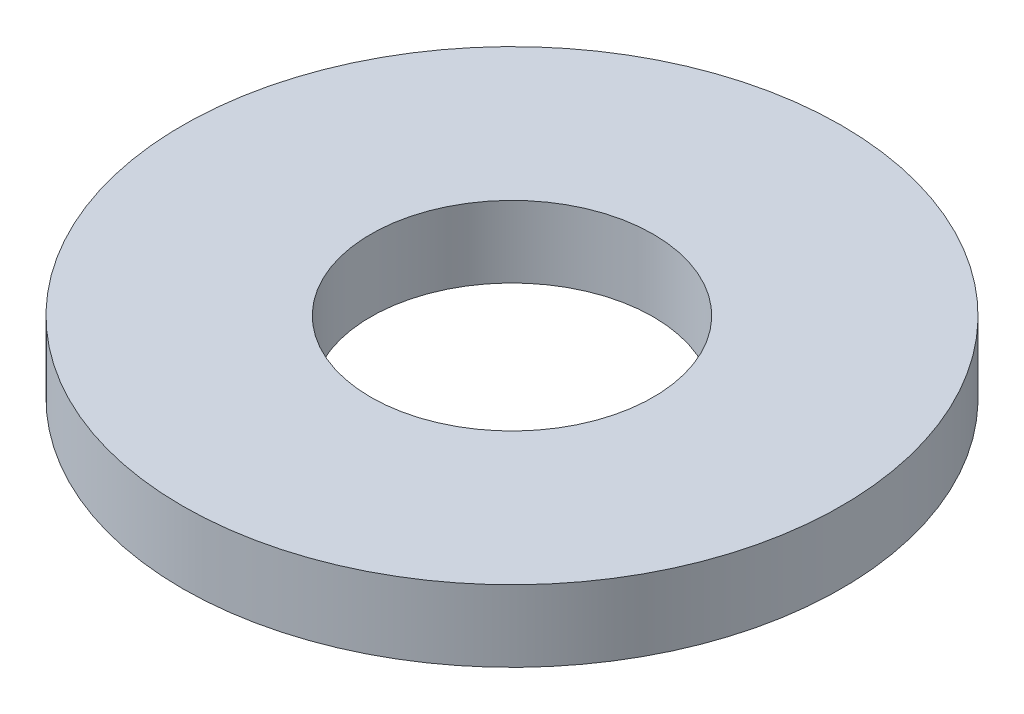
from build123d import *

# Parameters (mm, degrees)
SKETCH1_R           = 87.5
BOSS_EXTRUDE1_DEPTH = 19
SKETCH2_R           = 37.5
CUT_EXTRUDE1_DEPTH  = 126.193849689


with BuildPart() as part:
    # Sketch1 → Boss-Extrude1 (new body)
    with BuildSketch(Plane(origin=(0, 0, 0), x_dir=(1, 0, 0), z_dir=(0, 1, 0))):
        Circle(SKETCH1_R)
    extrude(amount=BOSS_EXTRUDE1_DEPTH)

    # Sketch2 → Cut-Extrude1 (cut, through all)
    with BuildSketch(Plane(origin=(0, 0, 0), x_dir=(1, 0, 0), z_dir=(0, 1, 0))):
        Circle(SKETCH2_R)
    extrude(amount=CUT_EXTRUDE1_DEPTH, mode=Mode.SUBTRACT)


solid = part.part
